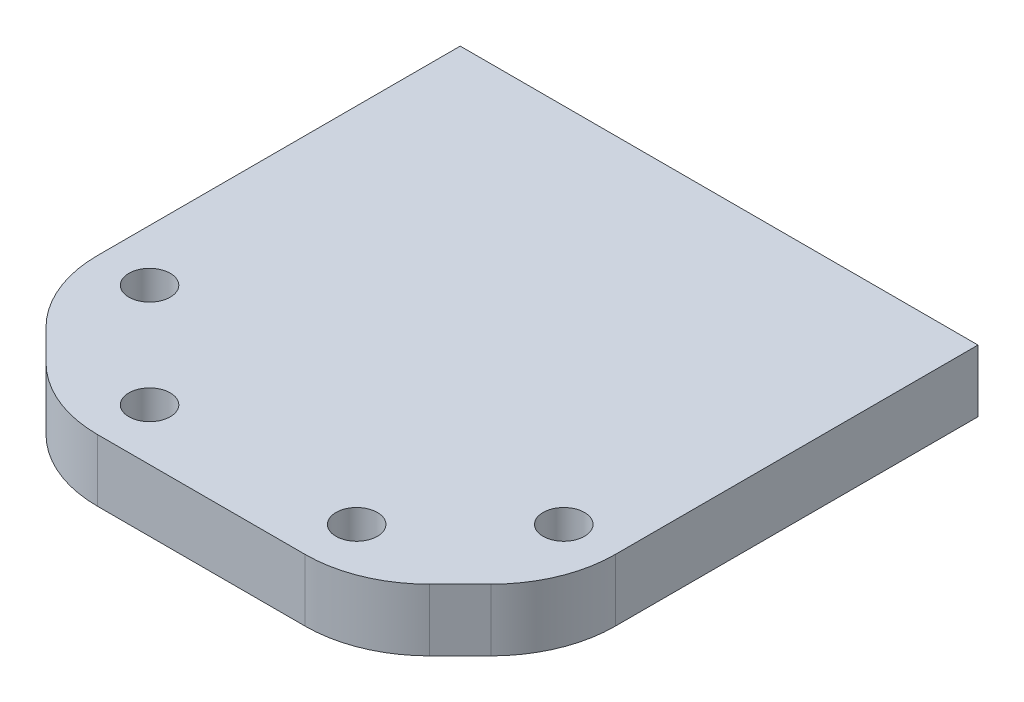
from build123d import *

# Parameters (mm, degrees)
CROQUIS1_R        = 1
BRIDA_BASE1_DEPTH = 3


# Sheet-metal steps are written as plain solids
with BuildPart() as part:
    # Croquis1 → Brida base1 (new body)
    with BuildSketch(Plane(origin=(0, 0, 0), x_dir=(1, 0, 0), z_dir=(0, 1, 0))):
        with BuildLine():
            Line((-5.014718626, 0), (5.014718626, 0))
            ThreePointArc((5.014718626, 0), (7.31081922, 0.456722805), (9.257359313, 1.757359313))
            Line((9.257359313, 1.757359313), (10.742640687, 3.242640687))
            ThreePointArc((10.742640687, 3.242640687), (12.043277195, 5.18918078), (12.5, 7.485281374))
            Line((12.5, 7.485281374), (12.5, 25))
            Line((12.5, 25), (-12.5, 25))
            Line((-12.5, 25), (-12.5, 7.485281374))
            ThreePointArc((-12.5, 7.485281374), (-12.043277195, 5.18918078), (-10.742640687, 3.242640687))
            Line((-10.742640687, 3.242640687), (-9.257359313, 1.757359313))
            ThreePointArc((-9.257359313, 1.757359313), (-7.31081922, 0.456722805), (-5.014718626, 0))
        make_face()
        with Locations(Location((-10, 7.5, 0), (0, 0, 270))):
            Circle(CROQUIS1_R, mode=Mode.SUBTRACT)
        with Locations(Location((-5, 2.5, 0), (0, 0, 270))):
            Circle(CROQUIS1_R, mode=Mode.SUBTRACT)
        with Locations(Location((10, 7.5, 0), (0, 0, 270))):
            Circle(CROQUIS1_R, mode=Mode.SUBTRACT)
        with Locations(Location((5, 2.5, 0), (0, 0, 270))):
            Circle(CROQUIS1_R, mode=Mode.SUBTRACT)
    extrude(amount=-BRIDA_BASE1_DEPTH)


solid = part.part
